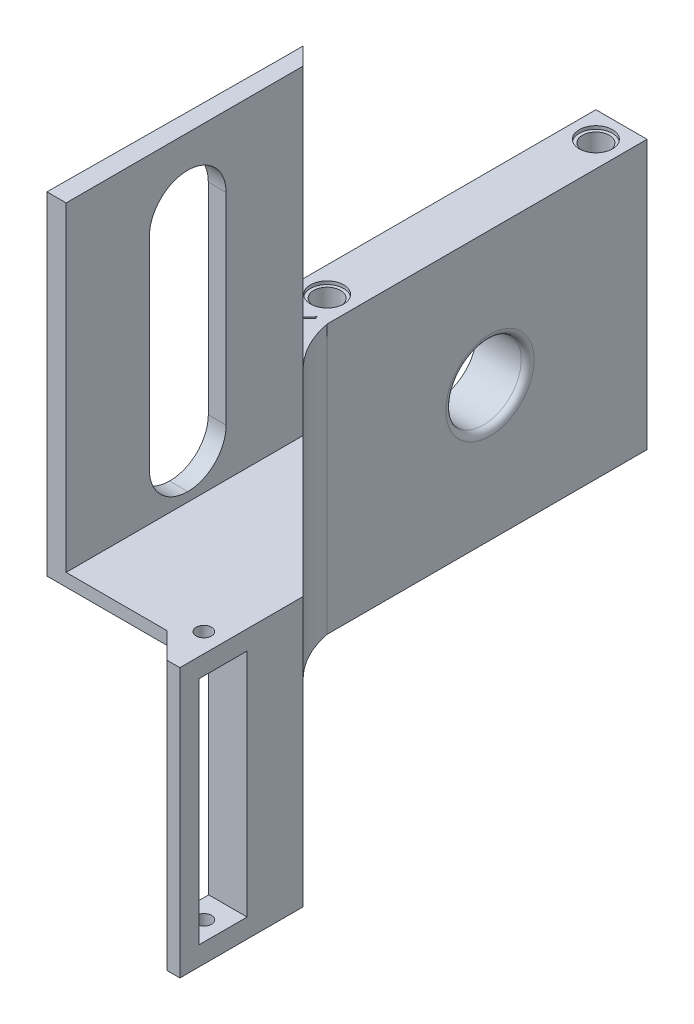
from build123d import *

# Parameters (mm, degrees)
SKETCH1_W           = 25
SKETCH1_H           = 50
SKETCH1_R           = 3.4
BOSS_EXTRUDE1_DEPTH = 3
SKETCH2_W           = 50
SKETCH2_H           = 3
BOSS_EXTRUDE2_DEPTH = 8
SKETCH3_W           = 8
SKETCH3_H           = 50
BOSS_EXTRUDE3_DEPTH = 42
SKETCH4_R           = 2.65
CUT_EXTRUDE1_DEPTH  = 0.5
SKETCH5_R           = 5.888972746
CUT_EXTRUDE2_DEPTH  = 9
FILLET2_R           = 1
SKETCH6_R           = 12.6
BOSS_EXTRUDE4_DEPTH = 2
FILLET4_R           = 1
SKETCH8_R           = 1.589780168
SKETCH8_R_2         = 1.777428262
CUT_EXTRUDE3_DEPTH  = 10
SKETCH9_W           = 49.021678163
SKETCH9_H           = 20.976854622
CUT_EXTRUDE4_DEPTH  = 68.79439129
SKETCH11_R          = 2.1
CUT_EXTRUDE5_DEPTH  = 59.480168703
SKETCH14_R          = 2.6
CUT_EXTRUDE6_DEPTH  = 0.5
BOSS_EXTRUDE5_DEPTH = 42
FILLET5_R           = 15
BOSS_EXTRUDE6_DEPTH = 42
SKETCH18_W          = 7.5
SKETCH18_H          = 36
CUT_EXTRUDE7_DEPTH  = 8
SKETCH19_R          = 1.2
CUT_EXTRUDE8_DEPTH  = 87.640868929
FILL_START          = -24.41711757
FILL_PATTERN1_DEPTH = 4.904046836
CHAMFER1_SIZE       = 4
CUT_EXTRUDE9_DEPTH  = 87.640868929
BOSS_EXTRUDE7_DEPTH = 2
BOSS_EXTRUDE8_DEPTH = 50
SKETCH23_W          = 11.999634841
SKETCH23_H          = 43.48627111
CUT_EXTRUDE10_DEPTH = 91.643207427
FILLET6_R           = 6
FILLET7_R           = 6
FILLET8_R           = 6
FILLET9_R           = 6


# Read off the part's stored shape, not the designer's step: Fill Pattern1
with BuildPart() as part:
    # Sketch1 → Boss-Extrude1 (new body)
    with BuildSketch(Plane(origin=(0, 0, 0), x_dir=(1, 0, 0), z_dir=(0, 1, 0))):
        with Locations((2.276951673, 11.384758364)):
            Rectangle(SKETCH1_W, SKETCH1_H)
        with Locations(Location((1.276951673, 11.384758364, 0), (0, 0, 270))):
            Circle(SKETCH1_R, mode=Mode.SUBTRACT)
    extrude(amount=BOSS_EXTRUDE1_DEPTH)

    # Sketch2 → Boss-Extrude2 (add)
    with BuildSketch(Plane.ZY.offset(10.223048327)):
        with Locations((-11.384758364, 1.5)):
            Rectangle(SKETCH2_W, SKETCH2_H)
    extrude(amount=BOSS_EXTRUDE2_DEPTH)

    # Sketch3 → Boss-Extrude3 (add)
    with BuildSketch(Plane.XZ):
        with Locations((-14.223048327, -11.384758364)):
            Rectangle(SKETCH3_W, SKETCH3_H)
    extrude(amount=BOSS_EXTRUDE3_DEPTH)

    # Sketch4 → Cut-Extrude1 (cut)
    with BuildSketch(Plane(origin=(0, 3, 0), x_dir=(1, 0, 0), z_dir=(0, 1, 0))):
        with Locations(Location((-14.223048327, 32.384758364, 0), (0, 0, 270))):
            Circle(SKETCH4_R)
        with Locations(Location((-14.223048327, -9.615241636, 0), (0, 0, 270))):
            Circle(SKETCH4_R)
    cut_extrude1 = extrude(amount=-CUT_EXTRUDE1_DEPTH, mode=Mode.SUBTRACT)

    # Mirror1: Cut-Extrude1 across plane
    add(cut_extrude1.mirror(Plane.ZX.offset(-19.5)), mode=Mode.SUBTRACT)

    # Sketch5 → Cut-Extrude2 (cut)
    with BuildSketch(Plane.ZY.offset(18.223048327)):
        with Locations((-11.836279124, -21)):
            Circle(SKETCH5_R)
    extrude(amount=-CUT_EXTRUDE2_DEPTH, mode=Mode.SUBTRACT)

    # Fillet2
    fillet2_edges = [part.edges().sort_by_distance(p)[0] for p in [
        (-10.223048327, -21, -17.72525187),
    ]]
    fillet(fillet2_edges, radius=FILLET2_R)

    # Mirror2: Cut-Extrude1 across plane
    add(cut_extrude1.mirror(Plane.ZY.offset(1.723048327)), mode=Mode.SUBTRACT)

    # Sketch6 → Boss-Extrude4 (add)
    with BuildSketch(Plane(origin=(0, 3, 0), x_dir=(1, 0, 0), z_dir=(0, 1, 0))):
        with BuildLine():
            Line((14.776951673, 5.825082115), (14.776951673, 16.944434614))
            ThreePointArc((14.776951673, 16.944434614), (-13.323048327, 11.384758364), (14.776951673, 5.825082115))
        make_face()
        with Locations(Location((1.276951673, 11.384758364, 0), (0, 0, 270))):
            Circle(SKETCH6_R, mode=Mode.SUBTRACT)
    extrude(amount=BOSS_EXTRUDE4_DEPTH)

    # Fillet4
    # the kernel refuses this fillet: 1 mm, written as the material it takes off along each edge
    with BuildSketch(Plane(origin=(14.776951673, 5, -3.325082115), x_dir=(0, -1, 0), z_dir=(0, 0, -1))) as fillet4_piece_1:
        with BuildLine():
            CenterArc((FILLET4_R, FILLET4_R), FILLET4_R, 180, 90)
            Line((0, FILLET4_R), (0, 0))
            Line((0, 0), (FILLET4_R, 0))
        make_face()
    extrude(amount=16.119352499, mode=Mode.SUBTRACT)

    # Sketch8 → Cut-Extrude3 (cut)
    with BuildSketch(Plane(origin=(0, 3, 0), x_dir=(1, 0, 0), z_dir=(0, 1, 0))):
        with Locations(Location((1.276951673, 19.884758364, 0), (0, 0, 270))):
            Circle(SKETCH8_R)
        with Locations(Location((1.276951673, 2.884758364, 0), (0, 0, 270))):
            Circle(SKETCH8_R_2)
    extrude(amount=-CUT_EXTRUDE3_DEPTH, mode=Mode.SUBTRACT)

    # Sketch9 → Cut-Extrude4 (cut, through all)
    with BuildSketch(Plane.XY.offset(13.615241636)):
        with Locations((-9.733887409, 10.488427311)):
            Rectangle(SKETCH9_W, SKETCH9_H)
    extrude(amount=-CUT_EXTRUDE4_DEPTH, mode=Mode.SUBTRACT)

    # Sketch11 → Cut-Extrude5 (cut, through all)
    with BuildSketch(Plane(origin=(0, 0, 0), x_dir=(1, 0, 0), z_dir=(0, 1, 0))):
        with Locations(Location((-14.223048327, 32.384758364, 0), (0, 0, 270))):
            Circle(SKETCH11_R)
    cut_extrude5 = extrude(amount=-CUT_EXTRUDE5_DEPTH, mode=Mode.SUBTRACT)

    # Mirror3: Cut-Extrude5 across plane
    add(cut_extrude5.mirror(Plane.XY.offset(-11.384758364)), mode=Mode.SUBTRACT)

    # Sketch14 → Cut-Extrude6 (cut)
    with BuildSketch(Plane(origin=(0, 0, 0), x_dir=(1, 0, 0), z_dir=(0, 1, 0))):
        with Locations(Location((-14.223048327, -9.615241636, 0), (0, 0, 270))):
            Circle(SKETCH14_R)
    cut_extrude6 = extrude(amount=-CUT_EXTRUDE6_DEPTH, mode=Mode.SUBTRACT)

    # Mirror4: Cut-Extrude6 across plane
    add(cut_extrude6.mirror(Plane.XY.offset(-11.384758364)), mode=Mode.SUBTRACT)

    # Sketch16 → Boss-Extrude5 (add)
    with BuildSketch(Plane(origin=(0, 0, 0), x_dir=(1, 0, 0), z_dir=(0, 1, 0))):
        Polygon((-18.223048327, -13.615241636), (24.776951673, -56.615241636), (24.776951673, -52.372600949), (-13.98040764, -13.615241636), align=None)
    extrude(amount=-BOSS_EXTRUDE5_DEPTH)

    # Fillet5
    # the kernel refuses this fillet: 15 mm, written as the material it adds along each edge
    with BuildSketch(Plane(origin=(-13.98040764, 0, 13.615241636), x_dir=(1, 0, 0), z_dir=(0, -1, 0))) as fillet5_piece_1:
        with BuildLine():
            CenterArc((18.512169169, -2.701034267), FILLET5_R, 135, 34.626223963)
            Line((7.905567451, 7.905567451), (0, 0))
            Line((0, 0), (3.757359313, 0))
        make_face()
    extrude(amount=42)

    # Sketch17 → Boss-Extrude6 (add)
    with BuildSketch(Plane(origin=(0, 0, 0), x_dir=(1, 0, 0), z_dir=(0, 1, 0))):
        Polygon((24.776951673, -56.615241636), (24.776951673, -71.615241636), (18.776951673, -71.615241636), (18.776951673, -50.615241636), align=None)
    extrude(amount=-BOSS_EXTRUDE6_DEPTH)

    # Sketch18 → Cut-Extrude7 (cut)
    with BuildSketch(Plane(origin=(24.776951673, 0, 0), x_dir=(0, 0, -1), z_dir=(1, 0, 0))):
        with Locations((-64.865241636, -21)):
            Rectangle(SKETCH18_W, SKETCH18_H)
    extrude(amount=-CUT_EXTRUDE7_DEPTH, mode=Mode.SUBTRACT)

    # Sketch19 → Cut-Extrude8 (cut, through all)
    with BuildSketch(Plane(origin=(0, 0, 0), x_dir=(1, 0, 0), z_dir=(0, 1, 0))):
        with Locations(Location((21.776951673, -64.865241636, 0), (0, 0, 270))):
            Circle(SKETCH19_R)
    extrude(amount=-CUT_EXTRUDE8_DEPTH, mode=Mode.SUBTRACT)

    # Fill Pattern1 outline → Fill Pattern1 (cut)
    with BuildSketch(Plane(origin=(0, 0, 0), x_dir=(0.7071067811865468, 0, 0.7071067811865482), z_dir=(0.7071067811865481, 0, -0.707106781186547)).offset(FILL_START)):
        Polygon((45.971737286, 5.859685187), (47.221737286, 3.694621678), (49.721737286, 3.694621678), (50.971737286, 5.859685187), (49.721737286, 8.024748697), (47.221737286, 8.024748697), align=None)
        Polygon((30.237460587, 33.11225185), (31.487460587, 30.947188341), (33.987460587, 30.947188341), (35.237460587, 33.11225185), (33.987460587, 35.27731536), (31.487460587, 35.27731536), align=None)
        Polygon((40.726978386, 14.943874075), (41.976978386, 12.778810565), (44.476978386, 12.778810565), (45.726978386, 14.943874075), (44.476978386, 17.108937584), (41.976978386, 17.108937584), align=None)
        Polygon((35.482219487, 24.028062963), (36.732219487, 21.862999453), (39.232219487, 21.862999453), (40.482219487, 24.028062963), (39.232219487, 26.193126472), (36.732219487, 26.193126472), align=None)
        Polygon((15.753183888, 3.694621678), (18.253183888, 3.694621678), (19.503183888, 5.859685187), (18.253183888, 8.024748697), (15.753183888, 8.024748697), (14.503183888, 5.859685187), align=None)
        Polygon((26.242701687, 3.694621678), (28.742701687, 3.694621678), (29.992701687, 5.859685187), (28.742701687, 8.024748697), (26.242701687, 8.024748697), (24.992701687, 5.859685187), align=None)
        Polygon((36.732219487, 3.694621678), (39.232219487, 3.694621678), (40.482219487, 5.859685187), (39.232219487, 8.024748697), (36.732219487, 8.024748697), (35.482219487, 5.859685187), align=None)
        Polygon((45.971737286, 11.915811112), (47.221737286, 9.750747603), (49.721737286, 9.750747603), (50.971737286, 11.915811112), (49.721737286, 14.080874622), (47.221737286, 14.080874622), align=None)
        Polygon((40.726978386, 21), (41.976978386, 18.834936491), (44.476978386, 18.834936491), (45.726978386, 21), (44.476978386, 23.165063509), (41.976978386, 23.165063509), align=None)
        Polygon((35.482219487, 30.084188888), (36.732219487, 27.919125378), (39.232219487, 27.919125378), (40.482219487, 30.084188888), (39.232219487, 32.249252397), (36.732219487, 32.249252397), align=None)
        Polygon((15.753183888, 9.750747603), (18.253183888, 9.750747603), (19.503183888, 11.915811112), (18.253183888, 14.080874622), (15.753183888, 14.080874622), (14.503183888, 11.915811112), align=None)
        Polygon((26.242701687, 9.750747603), (28.742701687, 9.750747603), (29.992701687, 11.915811112), (28.742701687, 14.080874622), (26.242701687, 14.080874622), (24.992701687, 11.915811112), align=None)
        Polygon((36.732219487, 9.750747603), (39.232219487, 9.750747603), (40.482219487, 11.915811112), (39.232219487, 14.080874622), (36.732219487, 14.080874622), (35.482219487, 11.915811112), align=None)
        Polygon((45.971737286, 17.971937037), (47.221737286, 15.806873528), (49.721737286, 15.806873528), (50.971737286, 17.971937037), (49.721737286, 20.137000547), (47.221737286, 20.137000547), align=None)
        Polygon((40.726978386, 27.056125925), (41.976978386, 24.891062416), (44.476978386, 24.891062416), (45.726978386, 27.056125925), (44.476978386, 29.221189435), (41.976978386, 29.221189435), align=None)
        Polygon((35.482219487, 36.140314813), (36.732219487, 33.975251303), (39.232219487, 33.975251303), (40.482219487, 36.140314813), (39.232219487, 38.305378322), (36.732219487, 38.305378322), align=None)
        Polygon((15.753183888, 15.806873528), (18.253183888, 15.806873528), (19.503183888, 17.971937037), (18.253183888, 20.137000547), (15.753183888, 20.137000547), (14.503183888, 17.971937037), align=None)
        Polygon((26.242701687, 15.806873528), (28.742701687, 15.806873528), (29.992701687, 17.971937037), (28.742701687, 20.137000547), (26.242701687, 20.137000547), (24.992701687, 17.971937037), align=None)
        Polygon((36.732219487, 15.806873528), (39.232219487, 15.806873528), (40.482219487, 17.971937037), (39.232219487, 20.137000547), (36.732219487, 20.137000547), (35.482219487, 17.971937037), align=None)
        Polygon((44.476978386, 6.72268464), (45.726978386, 8.88774815), (44.476978386, 11.052811659), (41.976978386, 11.052811659), (40.726978386, 8.88774815), (41.976978386, 6.72268464), align=None)
        Polygon((45.971737286, 24.028062963), (47.221737286, 21.862999453), (49.721737286, 21.862999453), (50.971737286, 24.028062963), (49.721737286, 26.193126472), (47.221737286, 26.193126472), align=None)
        Polygon((40.726978386, 33.11225185), (41.976978386, 30.947188341), (44.476978386, 30.947188341), (45.726978386, 33.11225185), (44.476978386, 35.27731536), (41.976978386, 35.27731536), align=None)
        Polygon((15.753183888, 21.862999453), (18.253183888, 21.862999453), (19.503183888, 24.028062963), (18.253183888, 26.193126472), (15.753183888, 26.193126472), (14.503183888, 24.028062963), align=None)
        Polygon((26.242701687, 21.862999453), (28.742701687, 21.862999453), (29.992701687, 24.028062963), (28.742701687, 26.193126472), (26.242701687, 26.193126472), (24.992701687, 24.028062963), align=None)
        Polygon((45.971737286, 36.140314813), (47.221737286, 33.975251303), (49.721737286, 33.975251303), (50.971737286, 36.140314813), (49.721737286, 38.305378322), (47.221737286, 38.305378322), align=None)
        Polygon((15.753183888, 33.975251303), (18.253183888, 33.975251303), (19.503183888, 36.140314813), (18.253183888, 38.305378322), (15.753183888, 38.305378322), (14.503183888, 36.140314813), align=None)
        Polygon((26.242701687, 33.975251303), (28.742701687, 33.975251303), (29.992701687, 36.140314813), (28.742701687, 38.305378322), (26.242701687, 38.305378322), (24.992701687, 36.140314813), align=None)
        Polygon((33.987460587, 6.72268464), (35.237460587, 8.88774815), (33.987460587, 11.052811659), (31.487460587, 11.052811659), (30.237460587, 8.88774815), (31.487460587, 6.72268464), align=None)
        Polygon((45.971737286, 30.084188888), (47.221737286, 27.919125378), (49.721737286, 27.919125378), (50.971737286, 30.084188888), (49.721737286, 32.249252397), (47.221737286, 32.249252397), align=None)
        Polygon((15.753183888, 27.919125378), (18.253183888, 27.919125378), (19.503183888, 30.084188888), (18.253183888, 32.249252397), (15.753183888, 32.249252397), (14.503183888, 30.084188888), align=None)
        Polygon((26.242701687, 27.919125378), (28.742701687, 27.919125378), (29.992701687, 30.084188888), (28.742701687, 32.249252397), (26.242701687, 32.249252397), (24.992701687, 30.084188888), align=None)
        Polygon((19.747942788, 27.056125925), (20.997942788, 24.891062416), (23.497942788, 24.891062416), (24.747942788, 27.056125925), (23.497942788, 29.221189435), (20.997942788, 29.221189435), align=None)
        Polygon((19.747942788, 8.88774815), (20.997942788, 6.72268464), (23.497942788, 6.72268464), (24.747942788, 8.88774815), (23.497942788, 11.052811659), (20.997942788, 11.052811659), align=None)
        Polygon((33.987460587, 24.891062416), (35.237460587, 27.056125925), (33.987460587, 29.221189435), (31.487460587, 29.221189435), (30.237460587, 27.056125925), (31.487460587, 24.891062416), align=None)
        Polygon((19.747942788, 14.943874075), (20.997942788, 12.778810565), (23.497942788, 12.778810565), (24.747942788, 14.943874075), (23.497942788, 17.108937584), (20.997942788, 17.108937584), align=None)
        Polygon((31.487460587, 12.778810565), (33.987460587, 12.778810565), (35.237460587, 14.943874075), (33.987460587, 17.108937584), (31.487460587, 17.108937584), (30.237460587, 14.943874075), align=None)
        Polygon((19.747942788, 21), (20.997942788, 18.834936491), (23.497942788, 18.834936491), (24.747942788, 21), (23.497942788, 23.165063509), (20.997942788, 23.165063509), align=None)
        Polygon((31.487460587, 18.834936491), (33.987460587, 18.834936491), (35.237460587, 21), (33.987460587, 23.165063509), (31.487460587, 23.165063509), (30.237460587, 21), align=None)
        Polygon((20.997942788, 30.947188341), (23.497942788, 30.947188341), (24.747942788, 33.11225185), (23.497942788, 35.27731536), (20.997942788, 35.27731536), (19.747942788, 33.11225185), align=None)
    extrude(amount=FILL_PATTERN1_DEPTH, mode=Mode.SUBTRACT)

    # Chamfer1
    # the kernel refuses this chamfer: 4 mm, written as the material it takes off along each edge
    with BuildSketch(Plane(origin=(18.776951673, 10.286731952, 71.615241636), x_dir=(0.9996219169112968, 0, 0.027495876610585623), z_dir=(0, -1, 0))) as chamfer1_piece_1:
        Polygon((CHAMFER1_SIZE * 0.999621916911, -CHAMFER1_SIZE * 0.0274958766106), (-CHAMFER1_SIZE * 0.0274958766106, -CHAMFER1_SIZE * 0.999621916911), (0, 0), align=None)
    extrude(amount=62.573463904, mode=Mode.SUBTRACT)

    # Sketch20 → Cut-Extrude9 (cut, through all)
    with BuildSketch(Plane(origin=(0, 0, 0), x_dir=(1, 0, 0), z_dir=(0, 1, 0))):
        Polygon((-12.007369699, -13.422049918), (-13.646299524, -15.19356362), (-10.796749548, -17.829847178), (-10.525107778, -17.536230508), (-13.131913788, -15.124523438), (-11.876337797, -13.743390342), align=None)
    extrude(amount=-CUT_EXTRUDE9_DEPTH, mode=Mode.SUBTRACT)

    # Sketch21 → Boss-Extrude7 (add)
    with BuildSketch(Plane(origin=(0, 0, 0), x_dir=(1, 0, 0), z_dir=(0, 1, 0))):
        Polygon((18.776951673, -67.615241636), (0, -67.615241636), (0.276951673, -32.115241636), (18.776951673, -50.615241636), align=None)
    extrude(amount=-BOSS_EXTRUDE7_DEPTH)

    # Sketch22 → Boss-Extrude8 (add)
    with BuildSketch(Plane(origin=(0, 0, 0), x_dir=(1, 0, 0), z_dir=(0, 1, 0))):
        Polygon((0, -67.615241636), (0.276951673, -32.115241636), (0.276951673, -27.872600949), (3, -30.595649276), (3, -67.615241636), align=None)
    extrude(amount=BOSS_EXTRUDE8_DEPTH)

    # Sketch23 → Cut-Extrude10 (cut, through all)
    with BuildSketch(Plane(origin=(0.527465201, 0, 0.004114996), x_dir=(-0.007801218175567637, 0, 0.9999695700344972), z_dir=(-0.9999695700344972, 0, -0.007801218175567637))):
        with Locations((48.589962083, 23.171442648)):
            Rectangle(SKETCH23_W, SKETCH23_H)
    extrude(amount=-CUT_EXTRUDE10_DEPTH, mode=Mode.SUBTRACT)

    # Fillet6
    fillet6_edges = [part.edges().sort_by_distance(p)[0] for p in [
        (1.597605095, 44.914578203, 42.603904364),
    ]]
    fillet(fillet6_edges, radius=FILLET6_R)

    # Fillet7
    # the kernel refuses this fillet: 6 mm, written as the material it adds along each edge
    with BuildSketch(Plane(origin=(0.101598421, 44.914578203, 54.592233334), x_dir=(0.007801218175567638, 0, -0.9999695700344972), z_dir=(0.9999695700344973, 0, 0.007801218175567638))) as fillet7_piece_1_section:
        with BuildLine():
            CenterArc((FILLET7_R, -FILLET7_R), FILLET7_R, 90, 90)
            Line((0, -FILLET7_R), (-FILLET7_R * 0.02, -FILLET7_R))
            Line((-FILLET7_R * 0.02, -FILLET7_R), (-FILLET7_R * 0.02, FILLET7_R * 0.02))
            Line((-FILLET7_R * 0.02, FILLET7_R * 0.02), (FILLET7_R, FILLET7_R * 0.02))
            Line((FILLET7_R, FILLET7_R * 0.02), (FILLET7_R, 0))
        make_face()
    fillet7_piece_1 = extrude(amount=17.89848978, mode=Mode.PRIVATE)
    fillet7_piece_1 = split(fillet7_piece_1, bisect_by=Plane(origin=(3, 43.553537309, 53.249688452), z_dir=(-1, 0, 0)), keep=Keep.TOP, mode=Mode.PRIVATE)
    add(fillet7_piece_1)

    # Fillet8
    fillet8_edges = [part.edges().sort_by_distance(p)[0] for p in [
        (1.597605095, 1.428307093, 42.603904364),
    ]]
    fillet(fillet8_edges, radius=FILLET8_R)

    # Fillet9
    # the kernel refuses this fillet: 6 mm, written as the material it adds along each edge
    with BuildSketch(Plane(origin=(0.101598421, 1.428307093, 54.592233334), x_dir=(0.007801218175567638, 0, -0.9999695700344972), z_dir=(0.9999695700344973, 0, 0.007801218175567638))) as fillet9_piece_1_section:
        with BuildLine():
            CenterArc((FILLET9_R, FILLET9_R), FILLET9_R, 180, 90)
            Line((0, FILLET9_R), (-FILLET9_R * 0.02, FILLET9_R))
            Line((-FILLET9_R * 0.02, FILLET9_R), (-FILLET9_R * 0.02, -FILLET9_R * 0.02))
            Line((-FILLET9_R * 0.02, -FILLET9_R * 0.02), (FILLET9_R, -FILLET9_R * 0.02))
            Line((FILLET9_R, -FILLET9_R * 0.02), (FILLET9_R, 0))
        make_face()
    fillet9_piece_1 = extrude(amount=17.89848978, mode=Mode.PRIVATE)
    fillet9_piece_1 = split(fillet9_piece_1, bisect_by=Plane(origin=(3, 2.789347988, 53.249688452), z_dir=(-1, 0, 0)), keep=Keep.TOP, mode=Mode.PRIVATE)
    add(fillet9_piece_1)


solid = part.part
